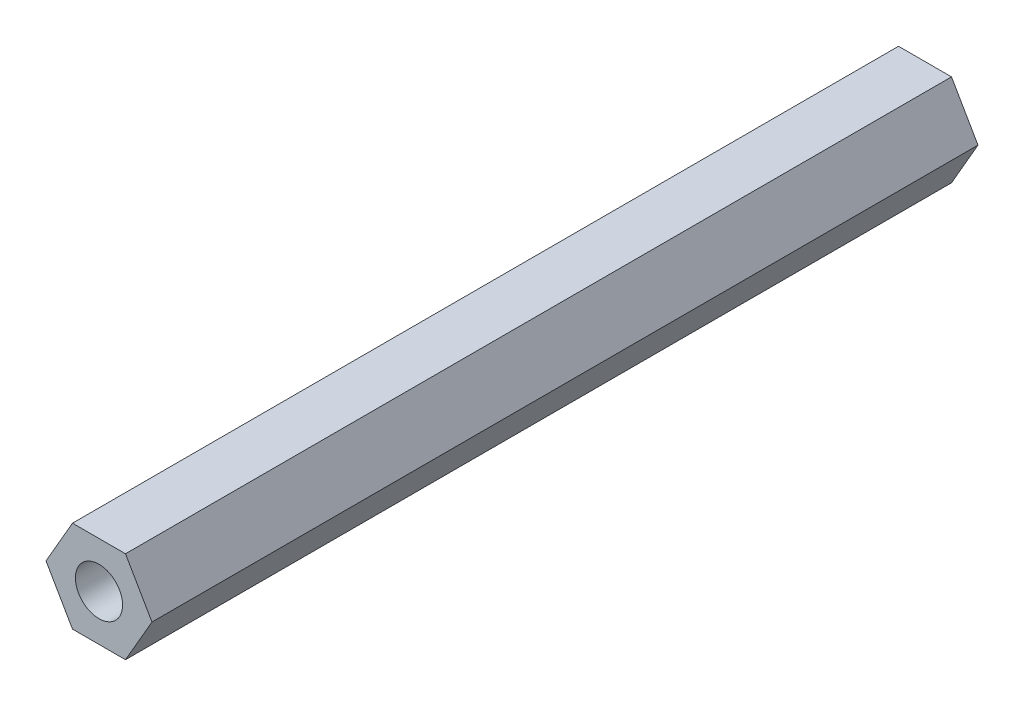
from build123d import *

# Parameters (mm, degrees)
SKETCH1_R           = 3.2639
BOSS_EXTRUDE1_DEPTH = 114.3


with BuildPart() as part:
    # Sketch1 → Boss-Extrude1 (new body)
    with BuildSketch(Plane.XY):
        Polygon((-3.666174209, 6.35), (-7.332348419, 0), (-3.666174209, -6.35), (3.666174209, -6.35), (7.332348419, 0), (3.666174209, 6.35), align=None)
        Circle(SKETCH1_R, mode=Mode.SUBTRACT)
    extrude(amount=BOSS_EXTRUDE1_DEPTH)


solid = part.part
